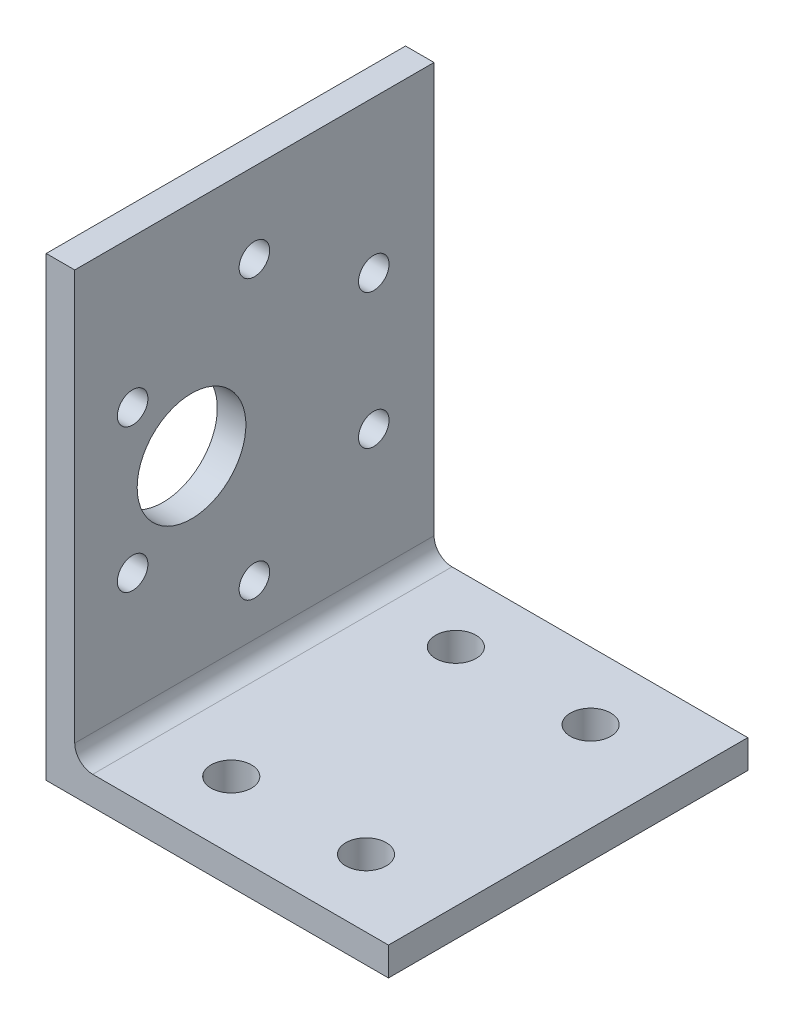
from build123d import *

# Parameters (mm, degrees)
BOSS_EXTRUDE1_DEPTH  = 20
FILLET1_R            = 2
M3_CLEARANCE_HOLE1_D = 3.4
SKETCH6_R            = 6.05
CUT_EXTRUDE1_DEPTH   = 67.575145512
M4_CLEARANCE_HOLE1_D = 4.5


with BuildPart() as part:
    # Sketch1 → Boss-Extrude1 (new, symmetric)
    with BuildSketch(Plane.XY):
        Polygon((0, 0), (0, 50.8), (3.175, 50.8), (3.175, 3.175), (38.1, 3.175), (38.1, 0), align=None)
    extrude(amount=BOSS_EXTRUDE1_DEPTH, both=True)

    # Fillet1
    fillet1_edges = [part.edges().sort_by_distance(p)[0] for p in [
        (3.175, 3.175, 0),
    ]]
    fillet(fillet1_edges, radius=FILLET1_R)

    # M3 Clearance Hole1 (through all)
    with Locations(Plane.ZY):
        with Locations((0, 41.847738991), (13.553804618, 34.328139243), (-13.289066718, 18.830400251), (0, 10.852261009), (-13.289066718, 33.869599749), (13.553804618, 18.371860757)):
            Hole(M3_CLEARANCE_HOLE1_D / 2)

    # Sketch6 → Cut-Extrude1 (cut, through all)
    with BuildSketch(Plane.ZY):
        with Locations((7, 26.35)):
            Circle(SKETCH6_R)
    extrude(amount=-CUT_EXTRUDE1_DEPTH, mode=Mode.SUBTRACT)

    # M4 Clearance Hole1 (through all)
    with Locations(Plane(origin=(0, 3.175, 0), x_dir=(1, 0, 0), z_dir=(0, 1, 0))):
        with Locations((13.1, -12.5), (28.1, -12.5), (28.1, 12.5), (13.1, 12.5)):
            Hole(M4_CLEARANCE_HOLE1_D / 2)


solid = part.part
